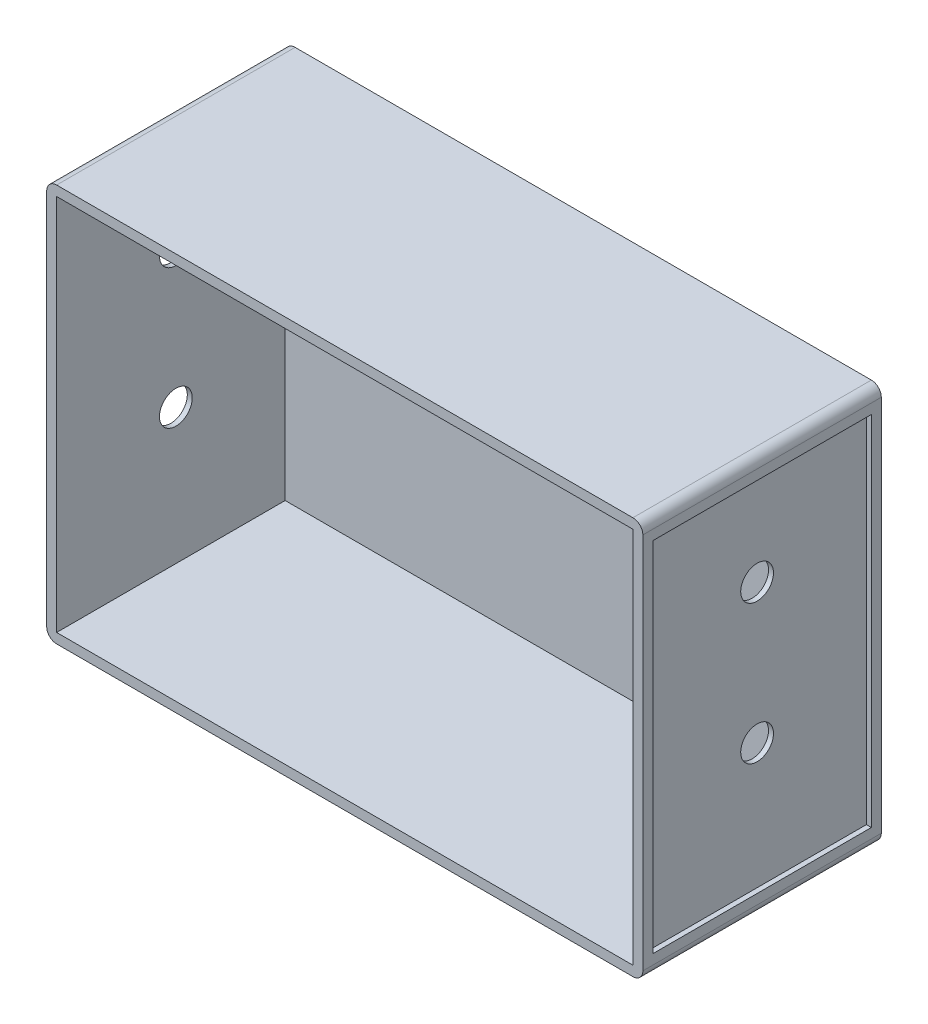
from build123d import *

# Parameters (mm, degrees)
SKETCH1_W           = 300
SKETCH1_H           = 200
BOSS_EXTRUDE1_DEPTH = 60
FILLET1_R           = 5
SHELL1_START        = -145
SHELL1_OUTLINE_W    = 190
SHELL1_OUTLINE_H    = 115
SHELL1_DEPTH        = 290
SKETCH5_W           = 110
SKETCH5_H           = 180
CUT_EXTRUDE1_DEPTH  = 2.5
SKETCH6_W           = 110
SKETCH6_H           = 180
CUT_EXTRUDE2_DEPTH  = 2.5
SKETCH7_R           = 8.25
CUT_EXTRUDE3_DEPTH  = 320.540685985


# Read off the part's stored shape, not the designer's step: Shell1
with BuildPart() as part:
    # Sketch1 → Boss-Extrude1 (new, symmetric)
    with BuildSketch(Plane.XY):
        Rectangle(SKETCH1_W, SKETCH1_H)
    extrude(amount=BOSS_EXTRUDE1_DEPTH, both=True)

    # Fillet1
    fillet1_edges = [part.edges().sort_by_distance(p)[0] for p in [
        (150, -100, 0),
        (-150, -100, 0),
        (-150, 100, 0),
        (150, 100, 0),
    ]]
    fillet(fillet1_edges, radius=FILLET1_R)

    # Shell1 outline → Shell1 (cut)
    with BuildSketch(Plane.YZ.offset(SHELL1_START)):
        with Locations((0, 2.5)):
            Rectangle(SHELL1_OUTLINE_W, SHELL1_OUTLINE_H)
    extrude(amount=SHELL1_DEPTH, mode=Mode.SUBTRACT)

    # Sketch5 → Cut-Extrude1 (cut)
    with BuildSketch(Plane(origin=(150, 0, 0), x_dir=(0, 0, -1), z_dir=(1, 0, 0))):
        Rectangle(SKETCH5_W, SKETCH5_H)
    extrude(amount=-CUT_EXTRUDE1_DEPTH, mode=Mode.SUBTRACT)

    # Sketch6 → Cut-Extrude2 (cut)
    with BuildSketch(Plane.ZY.offset(150)):
        Rectangle(SKETCH6_W, SKETCH6_H)
    extrude(amount=-CUT_EXTRUDE2_DEPTH, mode=Mode.SUBTRACT)

    # Sketch7 → Cut-Extrude3 (cut, through all)
    with BuildSketch(Plane.ZY.offset(147.5)):
        with Locations((0, 43.15529971)):
            Circle(SKETCH7_R)
        with Locations((0, -26.84470029)):
            Circle(SKETCH7_R)
    extrude(amount=-CUT_EXTRUDE3_DEPTH, mode=Mode.SUBTRACT)


solid = part.part
